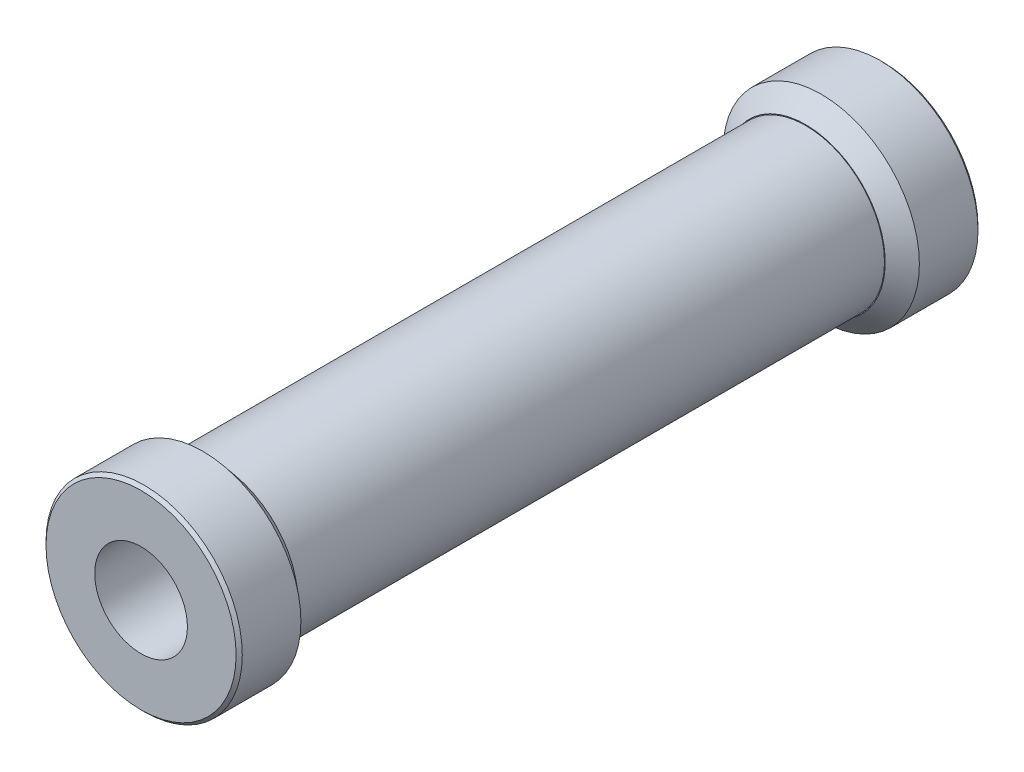
from build123d import *

# Parameters (mm, degrees)
IZIM1_W                     = 19
IZIM1_H                     = 2.55
IZIM4_R                     = 2.575
Y_KSEKLIK_EKSTR_ZYON1_DEPTH = 0.6
IZIM5_R                     = 3.175
Y_KSEKLIK_EKSTR_ZYON2_DEPTH = 1.9
IZIM7_R                     = 2.575
Y_KSEKLIK_EKSTR_ZYON4_DEPTH = 0.6
Y_KSEKLIK_EKSTR_ZYON5_START = 1.9
IZIM8_R                     = 3.175
Y_KSEKLIK_EKSTR_ZYON5_DEPTH = 1.9
IZIM9_R                     = 1.5
KES_EKSTR_ZYON1_DEPTH       = 100
PAH1_SIZE                   = 0.1


# Read off the part's stored shape, not the designer's step: Draft2, Draft3
with BuildPart() as part:
    # Çizim1 → Döndür3 (revolve)
    with BuildSketch(Plane(origin=(0, 0, 0), x_dir=(0, 0, -1), z_dir=(1, 0, 0)), mode=Mode.PRIVATE) as d_nd_r3_sk:
        with Locations((0, -1.275)):
            Rectangle(IZIM1_W, IZIM1_H)
    revolve(d_nd_r3_sk.sketch.rotate(Axis((0, 0, 15.544933078), (0, 0, -1)), 270), axis=Axis((0, 0, 15.544933078), (0, 0, -1)))

    # Çizim4 → Yükseklik-Ekstrüzyon1 (add)
    with BuildSketch(Plane(origin=(0, 0, -9.5), x_dir=(-1, 0, 0), z_dir=(0, 0, -1))):
        Circle(IZIM4_R)
    extrude(amount=Y_KSEKLIK_EKSTR_ZYON1_DEPTH)

    # Çizim5 → Yükseklik-Ekstrüzyon2 (add)
    with BuildSketch(Plane(origin=(0, 0, -10.1), x_dir=(-1, 0, 0), z_dir=(0, 0, -1))):
        with Locations(Location((0, 0, 0), (0, 0, 180))):
            Circle(IZIM5_R)
    extrude(amount=Y_KSEKLIK_EKSTR_ZYON2_DEPTH)

    # Draft2 outline → Draft2 (revolve)
    with BuildSketch(Plane.XZ):
        Polygon((3.175, -10.003459779), (2.575, -9.5), (2.575, -10.1), (3.175, -10.1), align=None)
    revolve(axis=Axis((0, 0, 0), (0, 0, 1)))

    # Çizim7 → Yükseklik-Ekstrüzyon4 (add)
    with BuildSketch(Plane.XY.offset(9.5)):
        Circle(IZIM7_R)
    extrude(amount=Y_KSEKLIK_EKSTR_ZYON4_DEPTH)

    # Çizim8 → Yükseklik-Ekstrüzyon5 (add)
    with BuildSketch(Plane.XY.offset(10.1).offset(Y_KSEKLIK_EKSTR_ZYON5_START)):
        Circle(IZIM8_R)
    extrude(amount=-Y_KSEKLIK_EKSTR_ZYON5_DEPTH)

    # Draft3 outline → Draft3 (revolve)
    with BuildSketch(Plane.XZ):
        Polygon((2.575, 9.5), (3.175, 10.003459779), (3.175, 10.1), (2.575, 10.1), align=None)
    revolve(axis=Axis((0, 0, 0), (0, 0, 1)))

    # Çizim9 → Kes-Ekstrüzyon1 (cut)
    with BuildSketch(Plane.XY.offset(12)):
        Circle(IZIM9_R)
    extrude(amount=-KES_EKSTR_ZYON1_DEPTH, mode=Mode.SUBTRACT)

    # Pah1
    pah1_edges = [part.edges().sort_by_distance(p)[0] for p in [
        (-3.175, 0, -12),
        (-3.175, 0, 12),
    ]]
    chamfer(pah1_edges, length=PAH1_SIZE)


solid = part.part
